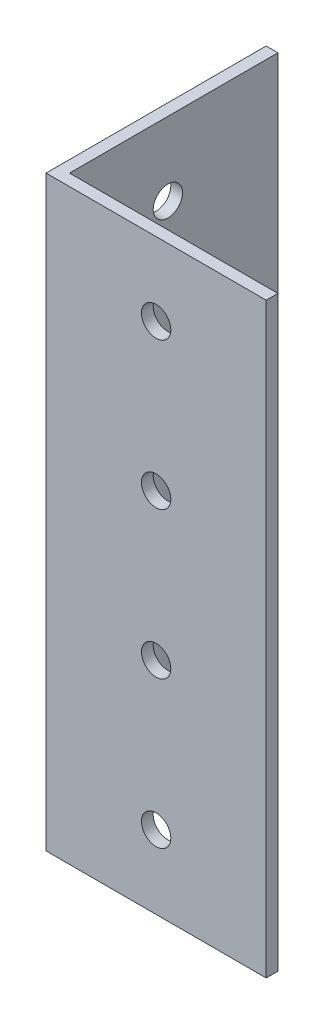
from build123d import *

# Parameters (mm, degrees)
EXTRUDE_1_DEPTH     = 200
SKETCH_2_R          = 5
CUT_EXTRUDE_1_DEPTH = 10
SKETCH_3_R          = 5
CUT_EXTRUDE_2_DEPTH = 10


with BuildPart() as part:
    # Эскиз1 → Вытянуть-Тонкостенный1 (new body)
    with BuildSketch(Plane(origin=(0, 0, 0), x_dir=(1, 0, 0), z_dir=(0, 1, 0))):
        Polygon((0, 75), (0, 0), (75, 0), (75, 4), (4, 4), (4, 75), align=None)
    extrude(amount=EXTRUDE_1_DEPTH)

    # Эскиз2 → Вырез-Вытянуть1 (cut)
    with BuildSketch(Plane.XY):
        with Locations((37.5, 175)):
            Circle(SKETCH_2_R)
        with Locations((37.5, 125)):
            Circle(SKETCH_2_R)
        with Locations((37.5, 75)):
            Circle(SKETCH_2_R)
        with Locations((37.5, 25)):
            Circle(SKETCH_2_R)
    extrude(amount=-CUT_EXTRUDE_1_DEPTH, mode=Mode.SUBTRACT)

    # Эскиз3 → Вырез-Вытянуть2 (cut)
    with BuildSketch(Plane.ZY):
        with Locations((-37.5, 175)):
            Circle(SKETCH_3_R)
        with Locations((-37.5, 125)):
            Circle(SKETCH_3_R)
        with Locations((-37.5, 75)):
            Circle(SKETCH_3_R)
        with Locations((-37.5, 25)):
            Circle(SKETCH_3_R)
    extrude(amount=-CUT_EXTRUDE_2_DEPTH, mode=Mode.SUBTRACT)


solid = part.part
